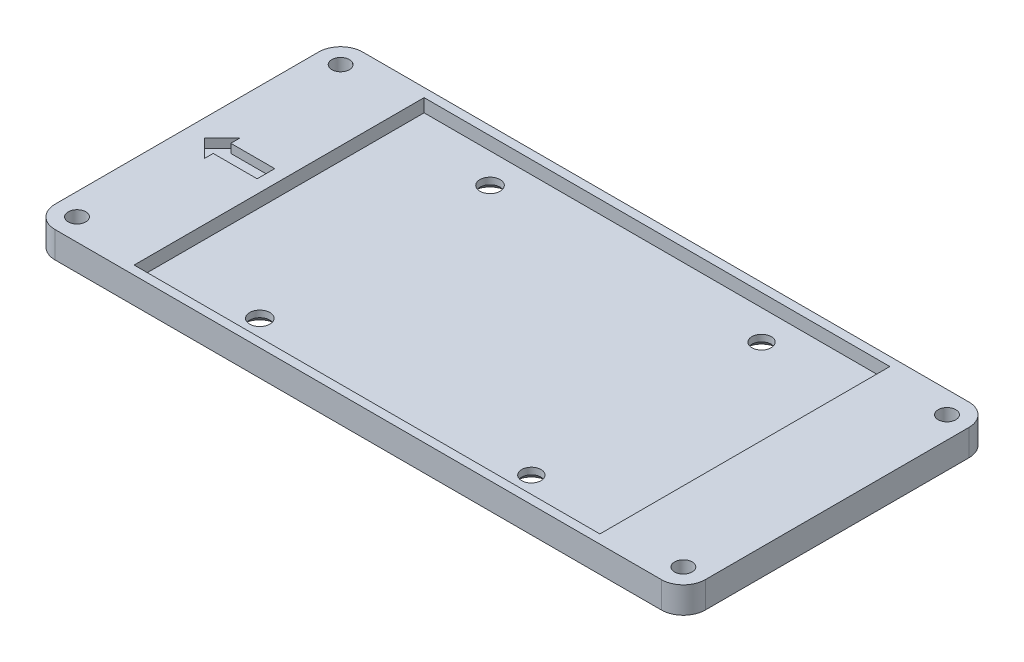
from build123d import *

# Parameters (mm, degrees)
SZKIC1_W                    = 74
SZKIC1_H                    = 35
DODANIE_WYCI_GNI_CIE1_DEPTH = 3
SZKIC2_W                    = 53
SZKIC2_H                    = 33
WYTNIJ_WYCI_GNI_CIE1_DEPTH  = 1.5
SZKIC4_R                    = 1
WYTNIJ_WYCI_GNI_CIE2_DEPTH  = 42.039615008
ZAOKR_GLENIE1_R             = 2.5
LUSTRO2_COPY_1_SKETCH_R     = 1
LUSTRO2_COPY_1_DEPTH        = 42.039615008
LUSTRO2_COPY_2_SKETCH_R     = 1
LUSTRO2_COPY_2_DEPTH        = 42.039615008
SZKIC6_R                    = 1.15
SZKIC6_R_2                  = 1.1
WYTNIJ_WYCI_GNI_CIE3_DEPTH  = 41.957294833
SFAZOWANIE1_SIZE            = 0.75
SFAZOWANIE1_OF_LUSTRO3_SIZE = 0.75
WYTNIJ_WYCI_GNI_CIE4_DEPTH  = 1


with BuildPart() as part:
    # Szkic1 → Dodanie-wyciągnięcie1 (new body)
    with BuildSketch(Plane(origin=(0, 0, 0), x_dir=(1, 0, 0), z_dir=(0, 1, 0))):
        Rectangle(SZKIC1_W, SZKIC1_H)
    extrude(amount=DODANIE_WYCI_GNI_CIE1_DEPTH)

    # Szkic2 → Wytnij-wyciągnięcie1 (cut)
    with BuildSketch(Plane(origin=(0, 3, 0), x_dir=(1, 0, 0), z_dir=(0, 1, 0))):
        Rectangle(SZKIC2_W, SZKIC2_H)
    extrude(amount=-WYTNIJ_WYCI_GNI_CIE1_DEPTH, mode=Mode.SUBTRACT)

    # Szkic4 → Wytnij-wyciągnięcie2 (cut, through all)
    with BuildSketch(Plane(origin=(0, 3, 0), x_dir=(1, 0, 0), z_dir=(0, 1, 0))):
        with Locations((-34.5, 15)):
            Circle(SZKIC4_R)
    wytnij_wyci_gni_cie2 = extrude(amount=-WYTNIJ_WYCI_GNI_CIE2_DEPTH, mode=Mode.SUBTRACT)

    # Zaokrąglenie1
    zaokr_glenie1_edges = [part.edges().sort_by_distance(p)[0] for p in [
        (-37, 1.5, 17.5),
        (-37, 1.5, -17.5),
        (37, 1.5, -17.5),
        (37, 1.5, 17.5),
    ]]
    fillet(zaokr_glenie1_edges, radius=ZAOKR_GLENIE1_R)

    # Lustro1: Wytnij-wyciągnięcie2 across plane
    add(wytnij_wyci_gni_cie2.mirror(Plane.XY), mode=Mode.SUBTRACT)

    # Lustro2 copy 1 sketch → Lustro2 copy 1 (cut, through all)
    with BuildSketch(Plane(origin=(0, 3, 0), x_dir=(-1, 0, 0), z_dir=(0, 1, 0))):
        with Locations((-34.5, 15)):
            Circle(LUSTRO2_COPY_1_SKETCH_R)
    extrude(amount=-LUSTRO2_COPY_1_DEPTH, mode=Mode.SUBTRACT)

    # Lustro2 copy 2 sketch → Lustro2 copy 2 (cut, through all)
    with BuildSketch(Plane(origin=(0, 3, 0), x_dir=(-1, 0, 0), z_dir=(0, 1, 0))):
        with Locations((-34.5, -15)):
            Circle(LUSTRO2_COPY_2_SKETCH_R)
    extrude(amount=-LUSTRO2_COPY_2_DEPTH, mode=Mode.SUBTRACT)

    # Szkic6 → Wytnij-wyciągnięcie3 (cut, through all)
    with BuildSketch(Plane(origin=(0, 1.5, 0), x_dir=(1, 0, 0), z_dir=(0, 1, 0))):
        with Locations((-15.6, -13.1)):
            Circle(SZKIC6_R)
        with Locations((15.3, -13.1)):
            Circle(SZKIC6_R_2)
    wytnij_wyci_gni_cie3 = extrude(amount=-WYTNIJ_WYCI_GNI_CIE3_DEPTH, mode=Mode.SUBTRACT)

    # Sfazowanie1
    sfazowanie1_edges = [part.edges().sort_by_distance(p)[0] for p in [
        (14.2, 0, 13.1),
        (-16.75, 0, 13.1),
    ]]
    chamfer(sfazowanie1_edges, length=SFAZOWANIE1_SIZE)

    # Lustro3: Wytnij-wyciągnięcie3 across plane
    add(wytnij_wyci_gni_cie3.mirror(Plane.XY), mode=Mode.SUBTRACT)

    # Sfazowanie1 of Lustro3
    sfazowanie1_of_lustro3_edges = [part.edges().sort_by_distance(p)[0] for p in [
        (14.2, 0, -13.1),
        (-16.75, 0, -13.1),
    ]]
    chamfer(sfazowanie1_of_lustro3_edges, length=SFAZOWANIE1_OF_LUSTRO3_SIZE)

    # Szkic7 → Wytnij-wyciągnięcie4 (cut)
    with BuildSketch(Plane(origin=(0, 3, 0), x_dir=(1, 0, 0), z_dir=(0, 1, 0))):
        Polygon((-35, 0), (-33, 2), (-33, 1), (-28, 1), (-28, -1), (-33, -1), (-33, -2), align=None)
    extrude(amount=-WYTNIJ_WYCI_GNI_CIE4_DEPTH, mode=Mode.SUBTRACT)


solid = part.part
